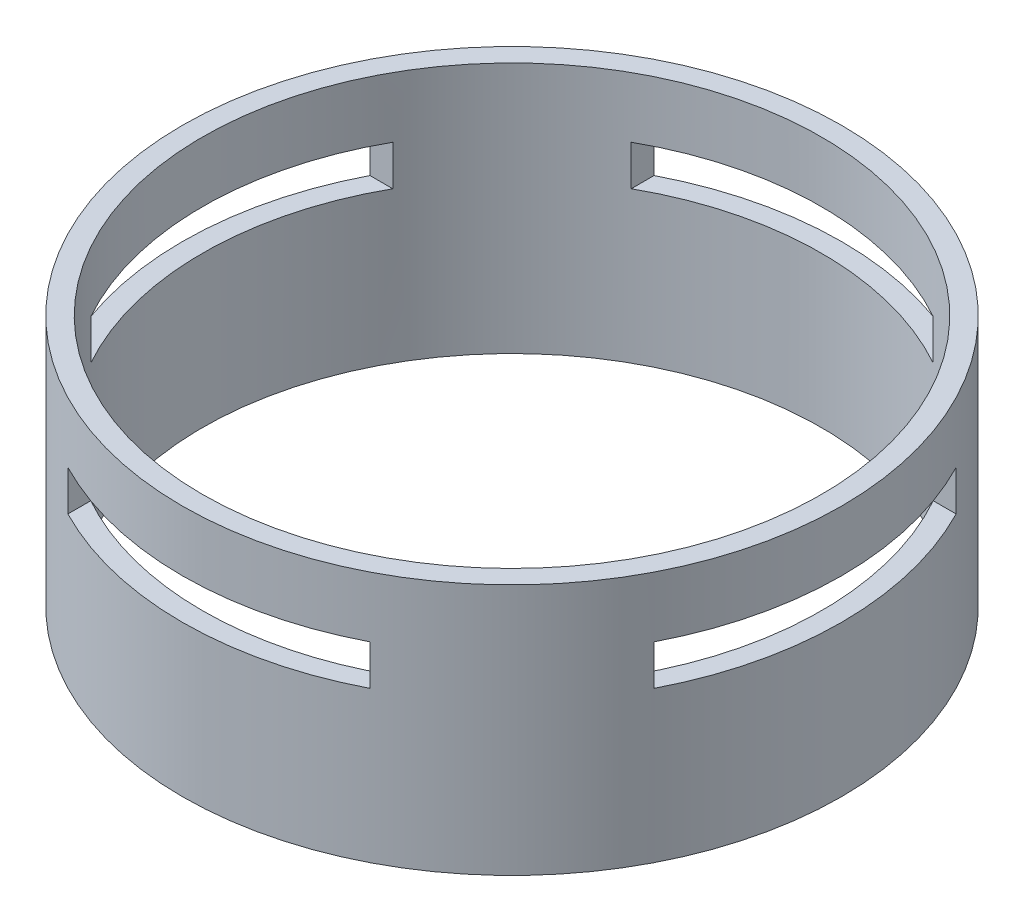
from build123d import *

# Parameters (mm, degrees)
ESQUISSE1_R                  = 32.75
ESQUISSE1_R_2                = 30.75
BOSS_EXTRU_1_DEPTH           = 25
ESQUISSE2_W                  = 30
ESQUISSE2_H                  = 4
ENL_V_MAT_EXTRU_1_DEPTH      = 53.631976972
R_P_TITION_CIRCULAIRE1_COUNT = 4


with BuildPart() as part:
    # Esquisse1 → Boss.-Extru.1 (new body)
    with BuildSketch(Plane(origin=(0, 0, 0), x_dir=(1, 0, 0), z_dir=(0, 1, 0))):
        Circle(ESQUISSE1_R)
        Circle(ESQUISSE1_R_2, mode=Mode.SUBTRACT)
    extrude(amount=BOSS_EXTRU_1_DEPTH)

    # Esquisse2 → Enlèv. mat.-Extru.1 (cut, through all)
    with BuildSketch(Plane.XY):
        with Locations((0, 17)):
            Rectangle(ESQUISSE2_W, ESQUISSE2_H)
    enl_v_mat_extru_1 = extrude(amount=-ENL_V_MAT_EXTRU_1_DEPTH, mode=Mode.SUBTRACT)

    # Répétition circulaire1: Enlèv. mat.-Extru.1 ×4 about axis
    r_p_tition_circulaire1_axis = Axis((0, 25, 0), (0, -1, 0))
    for i in range(1, R_P_TITION_CIRCULAIRE1_COUNT):
        add(enl_v_mat_extru_1.rotate(r_p_tition_circulaire1_axis, i * 360 / R_P_TITION_CIRCULAIRE1_COUNT), mode=Mode.SUBTRACT)


solid = part.part
